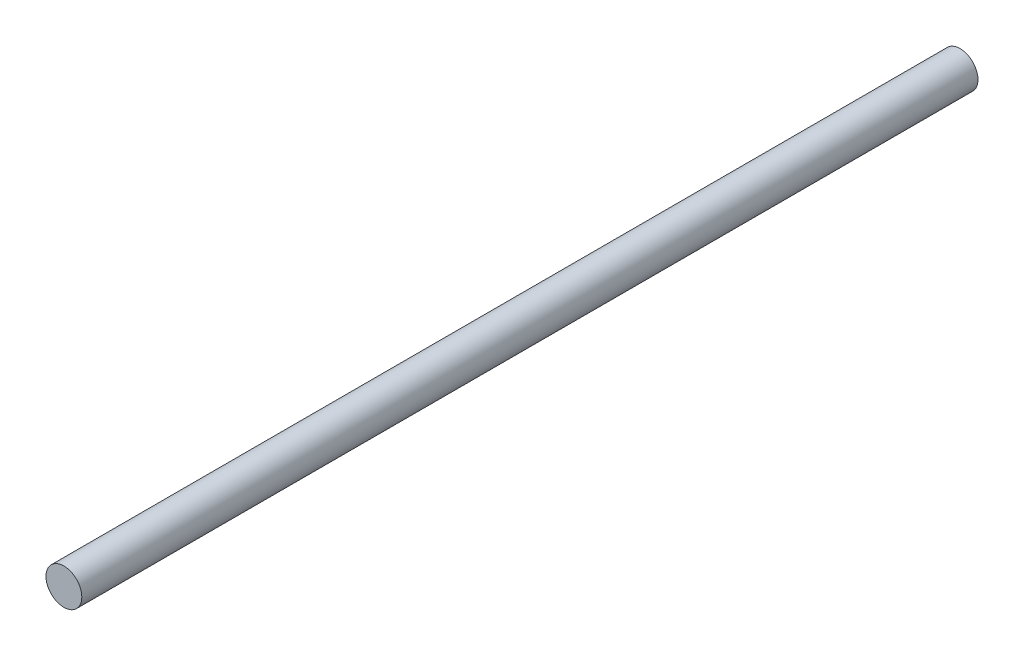
from build123d import *

# Parameters (mm, degrees)
SKETCH2_R           = 6
BOSS_EXTRUDE1_DEPTH = 300


with BuildPart() as part:
    # Sketch2 → Boss-Extrude1 (new body)
    with BuildSketch(Plane.XY):
        Circle(SKETCH2_R)
    extrude(amount=BOSS_EXTRUDE1_DEPTH)


solid = part.part
